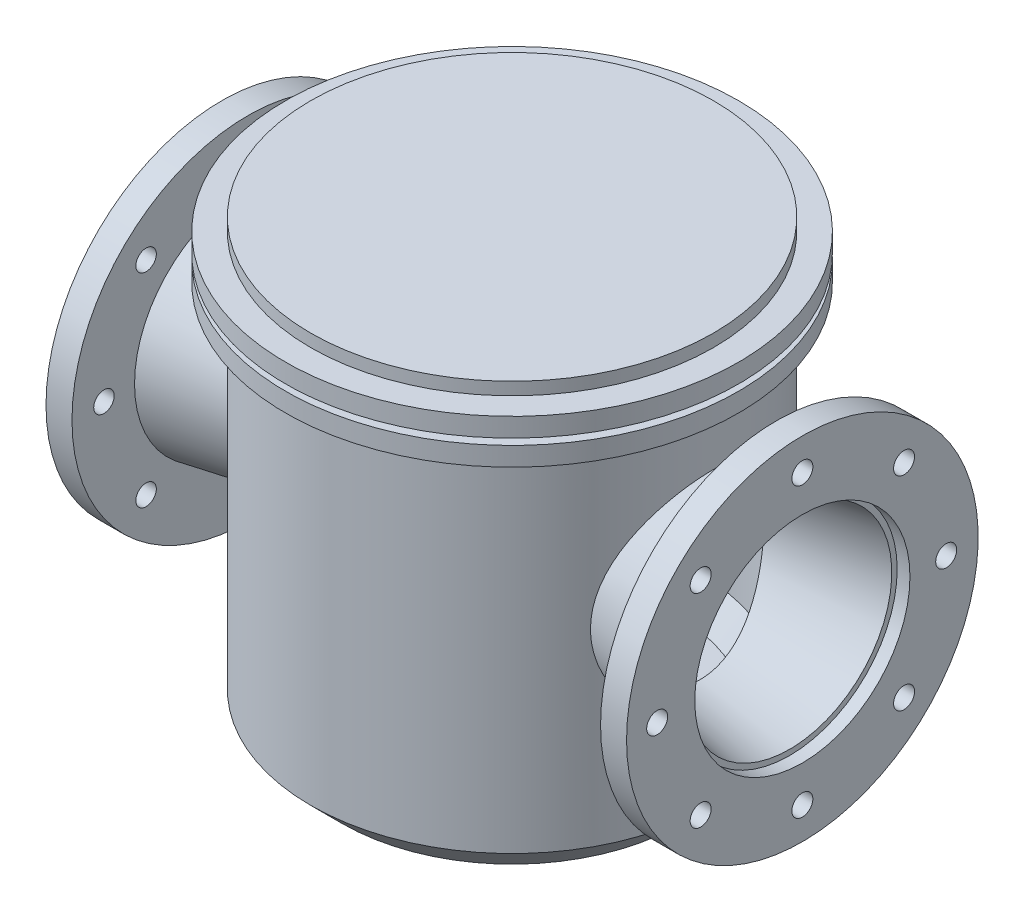
from build123d import *

# Parameters (mm, degrees)
SKETCH2_W                   = 20
SKETCH2_H                   = 15
SHELL1_START                = -39.5000001
SHELL1_OUTLINE_R            = 85.5
SHELL1_DEPTH                = 79.0000001
SHELL1_START_2              = -235.4
SHELL1_2_OUTLINE_R          = 85.5
SHELL1_2_DEPTH              = 14.9
SHELL1_START_3              = 220.5
SHELL1_3_OUTLINE_R          = 85.5
SHELL1_3_DEPTH              = 14.9
SHELL1_START_4              = -145.650757695
SHELL1_4_OUTLINE_R          = 149.5
SHELL1_4_DEPTH              = 310.150757695
SHELL1_START_5              = -174.5
SHELL1_5_OUTLINE_R          = 39.5
SHELL1_5_DEPTH              = 89
SKETCH15_R                  = 96
CUT_EXTRUDE4_DEPTH          = 4.75
SKETCH14_R                  = 39.5
EXTRUDE2_DEPTH              = 10
F_5_8_CLEARANCE_HOLE5_D     = 16.27124
F_5_8_CLEARANCE_HOLE5_DEPTH = 20.65
F_5_8_CLEARANCE_HOLE6_D     = 16.66748
F_5_8_CLEARANCE_HOLE6_DEPTH = 20.65
SKETCH30_R                  = 96
CUT_EXTRUDE5_DEPTH          = 529.604474064


with BuildPart() as part:
    # Sketch1 → Base-Revolve (revolve)
    with BuildSketch(Plane.XY, mode=Mode.PRIVATE) as base_revolve_sk:
        Polygon((0, -185), (50, -185), (50, -175), (135, -175), (160, -150), (160, 175), (0, 175), align=None)
    revolve(base_revolve_sk.sketch.rotate(Axis((0, -64.079408138, 0), (0, 1, 0)), 90), axis=Axis((0, -64.079408138, 0), (0, 1, 0)))

    # Sketch2 → Boss-Revolve1 (revolve)
    with BuildSketch(Plane.XY, mode=Mode.PRIVATE) as boss_revolve1_sk:
        with Locations((170, 157.5)):
            Rectangle(SKETCH2_W, SKETCH2_H)
        with Locations((170, 137.5)):
            Rectangle(SKETCH2_W, SKETCH2_H)
    revolve(boss_revolve1_sk.sketch.rotate(Axis((0, 0, 0), (0, 1, 0)), 90), axis=Axis((0, 0, 0), (0, 1, 0)))

    # Sketch3 → Boss-Revolve2 (revolve)
    with BuildSketch(Plane.XY, mode=Mode.PRIVATE) as boss_revolve2_sk:
        Polygon((0, 0), (0, 52.971334051), (210, 90), (210, 139.7), (230.65, 139.7), (230.65, 96), (235.4, 96), (235.4, 0), align=None)
    boss_revolve2 = revolve(boss_revolve2_sk.sketch.rotate(Axis((0, 0, 0), (1, 0, 0)), 90), axis=Axis((0, 0, 0), (1, 0, 0)))

    # Mirror1: Boss-Revolve2 across plane
    add(boss_revolve2.mirror(Plane(origin=(0, 0, 0), x_dir=(0, 0, 1), z_dir=(1, 0, 0))))

    # Shell1: read off the stored shape, not the designer's step
    # Shell1 outline → Shell1 (cut)
    with BuildSketch(Plane.YZ.offset(SHELL1_START)):
        Circle(SHELL1_OUTLINE_R)
    extrude(amount=SHELL1_DEPTH, mode=Mode.SUBTRACT)

    # Shell1 2 outline → Shell1 2 (cut)
    with BuildSketch(Plane.YZ.offset(SHELL1_START_2)):
        Circle(SHELL1_2_OUTLINE_R)
    extrude(amount=SHELL1_2_DEPTH, mode=Mode.SUBTRACT)

    # Shell1 3 outline → Shell1 3 (cut)
    with BuildSketch(Plane.YZ.offset(SHELL1_START_3)):
        Circle(SHELL1_3_OUTLINE_R)
    extrude(amount=SHELL1_3_DEPTH, mode=Mode.SUBTRACT)

    # Shell1 4 outline → Shell1 4 (cut)
    with BuildSketch(Plane(origin=(0, 0, 0), x_dir=(1, 0, 0), z_dir=(0, 1, 0)).offset(SHELL1_START_4)):
        Circle(SHELL1_4_OUTLINE_R)
    extrude(amount=SHELL1_4_DEPTH, mode=Mode.SUBTRACT)

    # Shell1 5 outline → Shell1 5 (cut)
    with BuildSketch(Plane(origin=(0, 0, 0), x_dir=(1, 0, 0), z_dir=(0, 1, 0)).offset(SHELL1_START_5)):
        Circle(SHELL1_5_OUTLINE_R)
    extrude(amount=SHELL1_5_DEPTH, mode=Mode.SUBTRACT)

    # Shell1 6: loft between two sections, ruled curve by curve
    shell1_6_from = [
        Edge.make_three_point_arc((0, -164.5, 130.650757595), (130.650757595, -164.5, 0), (0, -164.5, -130.650757595)),
        Edge.make_three_point_arc((0, -164.5, -130.650757595), (-130.650757595, -164.5, 0), (0, -164.5, 130.650757595)),
    ]
    shell1_6_to = [
        Edge.make_three_point_arc((0, -145.650757595, 149.5), (149.5, -145.650757595, 0), (0, -145.650757595, -149.5)),
        Edge.make_three_point_arc((0, -145.650757595, -149.5), (-149.5, -145.650757595, 0), (0, -145.650757595, 149.5)),
    ]
    shell1_6 = Solid(Shell([*[Face.make_surface_from_curves(shell1_6_from[k], shell1_6_to[k]) for k in range(2)], Face(Wire(shell1_6_from)), Face(Wire(shell1_6_to))]))
    add(shell1_6, mode=Mode.SUBTRACT)

    # Shell1 7: loft between two sections, ruled curve by curve
    shell1_7_from = [
        Edge.make_three_point_arc((134.158642782, 41.530655606, 51.250412113), (134.158642782, -51.250412113, 41.530655606), (134.158642782, -41.530655606, -51.250412113)),
        Edge.make_three_point_arc((134.158642782, -41.530655606, -51.250412113), (134.158642782, 51.250412113, -41.530655606), (134.158642782, 41.530655606, 51.250412113)),
    ]
    shell1_7_to = [
        Edge.make_three_point_arc((220.5, 51.115651267, 63.078662127), (220.5, -63.078662127, 51.115651267), (220.5, -51.115651267, -63.078662127)),
        Edge.make_three_point_arc((220.5, -51.115651267, -63.078662127), (220.5, 63.078662127, -51.115651267), (220.5, 51.115651267, 63.078662127)),
    ]
    shell1_7 = Solid(Shell([*[Face.make_surface_from_curves(shell1_7_from[k], shell1_7_to[k]) for k in range(2)], Face(Wire(shell1_7_from)), Face(Wire(shell1_7_to))]))
    add(shell1_7, mode=Mode.SUBTRACT)

    # Shell1 8: loft between two sections, ruled curve by curve
    shell1_8_from = [
        Edge.make_three_point_arc((-134.158707207, 0, -65.965154404), (-134.158707207, -65.965154404, 0), (-134.158707207, 0, 65.965154404)),
        Edge.make_three_point_arc((-134.158707207, 0, 65.965154404), (-134.158707207, 65.965154404, 0), (-134.158707207, 0, -65.965154404)),
    ]
    shell1_8_to = [
        Edge.make_three_point_arc((-220.5, 0, -81.189453873), (-220.5, -81.189453873, 0), (-220.5, 0, 81.189453873)),
        Edge.make_three_point_arc((-220.5, 0, 81.189453873), (-220.5, 81.189453873, 0), (-220.5, 0, -81.189453873)),
    ]
    shell1_8 = Solid(Shell([*[Face.make_surface_from_curves(shell1_8_from[k], shell1_8_to[k]) for k in range(2)], Face(Wire(shell1_8_from)), Face(Wire(shell1_8_to))]))
    add(shell1_8, mode=Mode.SUBTRACT)

    # Sketch15 → Cut-Extrude4 (cut)
    with BuildSketch(Plane.ZY.offset(230.65)):
        Circle(SKETCH15_R)
    extrude(amount=CUT_EXTRUDE4_DEPTH, mode=Mode.SUBTRACT)

    # Sketch14 → Extrude2 (add)
    with BuildSketch(Plane(origin=(0, -174.5, 0), x_dir=(1, 0, 0), z_dir=(0, 1, 0))):
        Circle(SKETCH14_R)
    extrude(amount=EXTRUDE2_DEPTH)

    # 5/8 Clearance Hole5
    with Locations(Plane(origin=(-230.65, -86.94526051, 61.229912904), x_dir=(0, 0, 1), z_dir=(-1, 0, 0))):
        with Locations((-61.229912904, 201.24526051), (-176.596487394, 86.94526051), (-142.052217993, 167.767565599), (19.592392186, 167.767565599), (53.070087096, 86.94526051), (19.592392186, 6.12295542), (-61.229912904, -27.406492985), (-142.052217993, 6.12295542)):
            Hole(F_5_8_CLEARANCE_HOLE5_D / 2, depth=F_5_8_CLEARANCE_HOLE5_DEPTH)

    # 5/8 Clearance Hole6
    with Locations(Plane(origin=(230.65, 0, 0), x_dir=(0, 0, -1), z_dir=(1, 0, 0))):
        with Locations((-80.82230509, 80.82230509), (0, 114.3), (80.82230509, 80.82230509), (114.3, 0), (80.82230509, -80.82230509), (0, -114.351753494), (-80.82230509, -80.82230509), (-115.366574491, 0)):
            Hole(F_5_8_CLEARANCE_HOLE6_D / 2, depth=F_5_8_CLEARANCE_HOLE6_DEPTH)

    # Sketch30 → Cut-Extrude5 (cut, through all)
    with BuildSketch(Plane(origin=(230.65, 0, 0), x_dir=(0, 0, -1), z_dir=(1, 0, 0))):
        Circle(SKETCH30_R)
    extrude(amount=CUT_EXTRUDE5_DEPTH, mode=Mode.SUBTRACT)


solid = part.part
